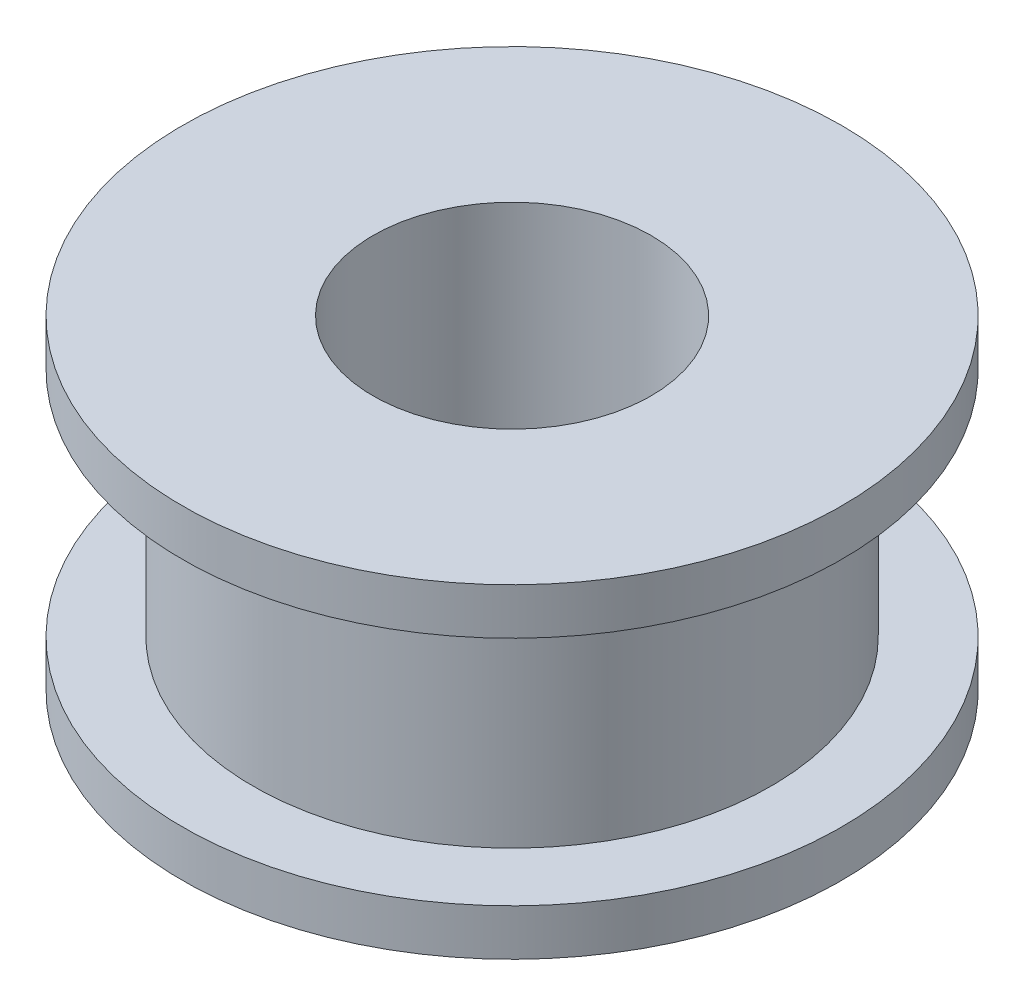
from build123d import *


with BuildPart() as part:
    # Sketch1 → Revolve1 (revolve)
    with BuildSketch(Plane.YZ):
        Polygon((0, 3.000000096), (-6.99999997, 3.000000096), (-6.99999997, 7.112), (-5.999999938, 7.112), (-5.999999938, 5.588), (-1.000000032, 5.588), (-1.000000032, 7.112), (0, 7.112), align=None)
    revolve(axis=Axis((0, -39.041586513, 0), (0, 1, 0)))


solid = part.part
